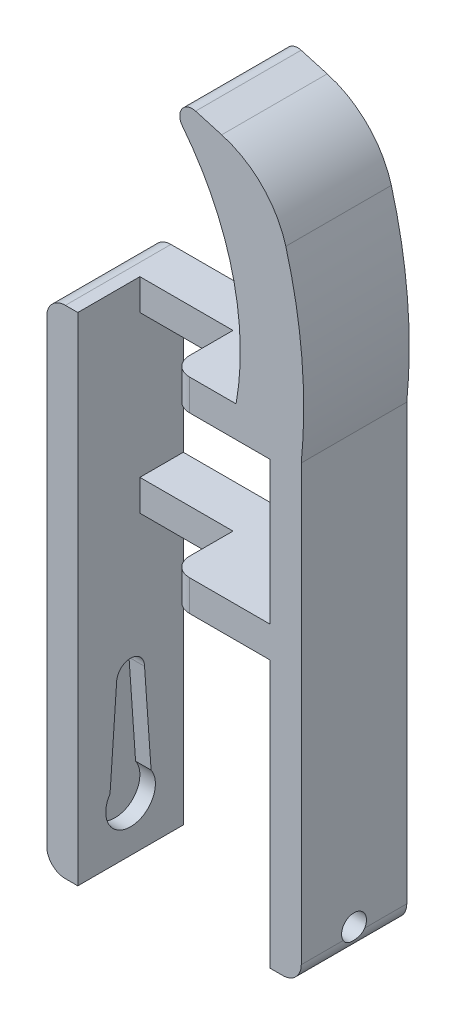
from build123d import *

# Parameters (mm, degrees)
SKETCH1_W             = 5
SKETCH1_H             = 17
BOSS_EXTRUDE1_DEPTH   = 80
BOSS_EXTRUDE1_2_DEPTH = 80
CUT_EXTRUDE1_DEPTH    = 2.5
SKETCH7_W             = 17
SKETCH7_H             = 4
CUT_EXTRUDE4_DEPTH    = 5
SKETCH8_R             = 2
CUT_EXTRUDE5_DEPTH    = 5
BOSS_EXTRUDE3_REACH   = 91.359
SKETCH9_W             = 7
SKETCH9_H             = 5
SKETCH10_W            = 10
SKETCH10_H            = 5
BOSS_EXTRUDE4_DEPTH   = 16
FILLET3_R             = 3
BOSS_EXTRUDE5_DEPTH   = 17
FILLET4_R             = 2
FILLET5_R             = 15


with BuildPart() as part:
    # Sketch1 → Boss-Extrude1 (new body)
    with BuildSketch(Plane(origin=(0, 0, 0), x_dir=(1, 0, 0), z_dir=(0, 1, 0))):
        with Locations((2.5, -8.5)):
            Rectangle(SKETCH1_W, SKETCH1_H)
    extrude(amount=BOSS_EXTRUDE1_DEPTH)

    # Sketch2 → Cut-Extrude1 (cut)
    with BuildSketch(Plane(origin=(5, 0, 0), x_dir=(0, 0, -1), z_dir=(1, 0, 0))):
        with BuildLine():
            Line((-10.75, 25.267799715), (-11.807189139, 10.25))
            ThreePointArc((-11.807189139, 10.25), (-8.5, 12), (-5.192810861, 10.25))
            Line((-5.192810861, 10.25), (-6.25, 25.267799715))
            ThreePointArc((-6.25, 25.267799715), (-8.5, 27.517799715), (-10.75, 25.267799715))
        make_face()
        with BuildLine():
            ThreePointArc((-5.192810861, 10.25), (-8.5, 12), (-11.807189139, 10.25))
            Line((-11.807189139, 10.25), (-11.807189139, 5.75))
            ThreePointArc((-11.807189139, 5.75), (-8.5, 4), (-5.192810861, 5.75))
            Line((-5.192810861, 5.75), (-5.192810861, 10.25))
        make_face()
        with BuildLine():
            Line((-11.807189139, 5.75), (-11.807189139, 10.25))
            ThreePointArc((-11.807189139, 10.25), (-12.5, 8), (-11.807189139, 5.75))
        make_face()
        with BuildLine():
            ThreePointArc((-4.5, 8), (-4.677124344, 9.177124344), (-5.192810861, 10.25))
            Line((-5.192810861, 10.25), (-5.192810861, 5.75))
            ThreePointArc((-5.192810861, 5.75), (-4.677124344, 6.822875656), (-4.5, 8))
        make_face()
    extrude(amount=-CUT_EXTRUDE1_DEPTH, mode=Mode.SUBTRACT)


with BuildPart() as body_2:
    # Sketch1 → Boss-Extrude1 2 (new body)
    with BuildSketch(Plane(origin=(0, 0, 0), x_dir=(1, 0, 0), z_dir=(0, 1, 0))):
        with Locations((38.5, -8.5)):
            Rectangle(SKETCH1_W, SKETCH1_H)
    extrude(amount=BOSS_EXTRUDE1_2_DEPTH)

    # Sketch7 → Cut-Extrude4 (cut)
    with BuildSketch(Plane(origin=(41, 0, 0), x_dir=(0, 0, -1), z_dir=(1, 0, 0))):
        with Locations((-8.5, 2)):
            Rectangle(SKETCH7_W, SKETCH7_H)
    extrude(amount=-CUT_EXTRUDE4_DEPTH, mode=Mode.SUBTRACT)

    # Sketch8 → Cut-Extrude5 (cut)
    with BuildSketch(Plane(origin=(41, 0, 0), x_dir=(0, 0, -1), z_dir=(1, 0, 0))):
        with Locations((-8.5, 8)):
            Circle(SKETCH8_R)
    extrude(amount=-CUT_EXTRUDE5_DEPTH, mode=Mode.SUBTRACT)

    # Sketch9 → Boss-Extrude3 (add, up to next)
    with BuildSketch(Plane(origin=(5, 0, 0), x_dir=(0, 0, -1), z_dir=(1, 0, 0)), mode=Mode.PRIVATE) as boss_extrude3_sk1:
        with Locations((-3.5, 77.5)):
            Rectangle(SKETCH9_W, SKETCH9_H)
    boss_extrude3_tool1 = extrude(boss_extrude3_sk1.sketch, amount=BOSS_EXTRUDE3_REACH, mode=Mode.PRIVATE) - body_2.part
    # Sketch9 → Boss-Extrude3 (add, up to next)
    with BuildSketch(Plane(origin=(5, 0, 0), x_dir=(0, 0, -1), z_dir=(1, 0, 0)), mode=Mode.PRIVATE) as boss_extrude3_sk2:
        with Locations((-3.5, 49.5)):
            Rectangle(SKETCH9_W, SKETCH9_H)
    boss_extrude3_tool2 = extrude(boss_extrude3_sk2.sketch, amount=BOSS_EXTRUDE3_REACH, mode=Mode.PRIVATE) - body_2.part

    add(part.part)  # Boss-Extrude3 merges part
    add(boss_extrude3_tool1.solids().sort_by_distance((5, 77.5, 3.5))[0])
    add(boss_extrude3_tool2.solids().sort_by_distance((5, 49.5, 3.5))[0])

    # Sketch10 → Boss-Extrude4 (add)
    with BuildSketch(Plane.ZY.offset(-36)):
        with Locations((12, 77.5)):
            Rectangle(SKETCH10_W, SKETCH10_H)
        with Locations((12, 49.5)):
            Rectangle(SKETCH10_W, SKETCH10_H)
    extrude(amount=BOSS_EXTRUDE4_DEPTH)

    # Fillet3
    # the kernel refuses this fillet: 3 mm, written as the material it takes off along each edge
    with BuildSketch(Plane(origin=(41, 80, -7.5), x_dir=(0, -1, 0), z_dir=(0, 0, 1)), Plane(origin=(41, 4, 24.5), x_dir=(0, 1, 0), z_dir=(0, 0, -1))) as fillet3_piece_1:
        with BuildLine():
            CenterArc((FILLET3_R, -FILLET3_R), FILLET3_R, 90, 90)
            Line((0, -FILLET3_R), (0, 0))
            Line((0, 0), (FILLET3_R, 0))
        make_face()
    extrude(amount=32, mode=Mode.SUBTRACT)
    with BuildSketch(Plane(origin=(0, 80, 24.5), x_dir=(1, 0, 0), z_dir=(0, 0, -1)), Plane(origin=(0, 0, 24.5), x_dir=(0, 1, 0), z_dir=(0, 0, -1))) as fillet3_piece_2:
        with BuildLine():
            CenterArc((FILLET3_R, FILLET3_R), FILLET3_R, 180, 90)
            Line((0, FILLET3_R), (0, 0))
            Line((0, 0), (FILLET3_R, 0))
        make_face()
    extrude(amount=32, mode=Mode.SUBTRACT)
    with BuildSketch(Plane(origin=(20, 67.5, 17), x_dir=(0, 0, -1), z_dir=(0, 1, 0))) as fillet3_piece_3:
        with BuildLine():
            CenterArc((FILLET3_R, -FILLET3_R), FILLET3_R, 90, 90)
            Line((0, -FILLET3_R), (0, 0))
            Line((0, 0), (FILLET3_R, 0))
        make_face()
    extrude(amount=20, mode=Mode.SUBTRACT)
    with BuildSketch(Plane(origin=(20, 39.5, 17), x_dir=(1, 0, 0), z_dir=(0, 1, 0))) as fillet3_piece_4:
        with BuildLine():
            CenterArc((FILLET3_R, FILLET3_R), FILLET3_R, 180, 90)
            Line((0, FILLET3_R), (0, 0))
            Line((0, 0), (FILLET3_R, 0))
        make_face()
    extrude(amount=20, mode=Mode.SUBTRACT)

    # Sketch12 → Boss-Extrude5 (add, through all)
    with BuildSketch(Plane.XY.offset(17)):
        with BuildLine():
            Line((17.07120829, 119.558177775), (35.709852909, 114.232850741))
            ThreePointArc((35.709852909, 114.232850741), (40.614477912, 95.937468732), (41, 77))
            Line((41, 77), (30.5, 80))
            ThreePointArc((30.5, 80), (28.882999649, 101.509498789), (17.07120829, 119.558177775))
        make_face()
    extrude(amount=-BOSS_EXTRUDE5_DEPTH)

    # Fillet4
    fillet4_edges = [body_2.edges().sort_by_distance(p)[0] for p in [
        (17.07120829, 119.558177775, 8.5),
    ]]
    fillet(fillet4_edges, radius=FILLET4_R)

    # Fillet5
    fillet5_edges = [body_2.edges().sort_by_distance(p)[0] for p in [
        (35.709852909, 114.232850741, 8.5),
    ]]
    fillet(fillet5_edges, radius=FILLET5_R)


solid = body_2.part
